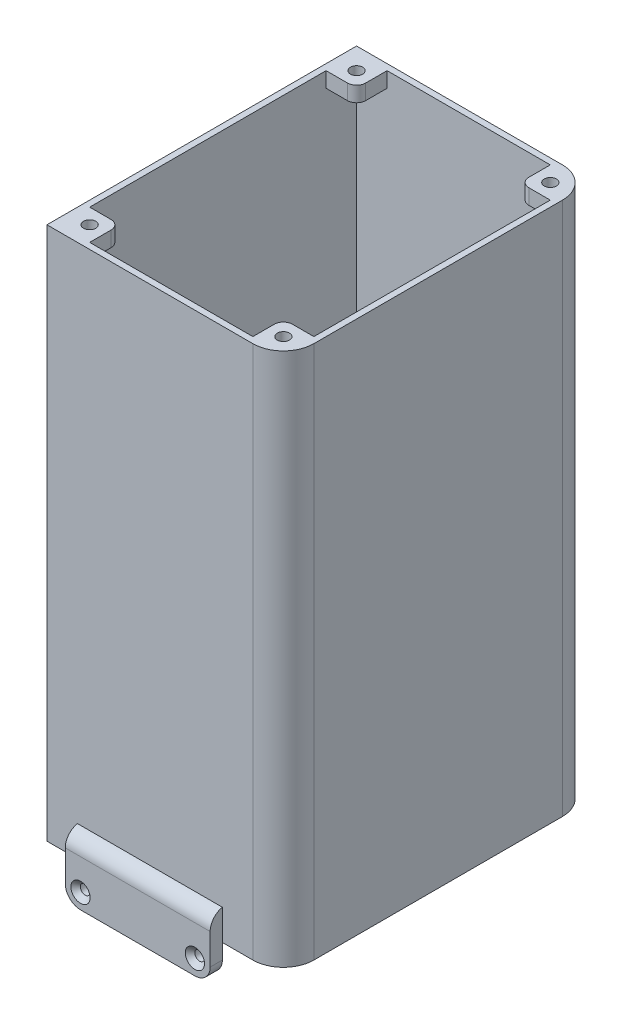
from build123d import *

# Parameters (mm, degrees)
BOSS_EXTRUDE1_DEPTH                             = 170
SKETCH3_R                                       = 2
BOSS_EXTRUDE2_DEPTH                             = 5
SKETCH4_W                                       = 47.5
SKETCH4_H                                       = 4
BOSS_EXTRUDE3_DEPTH                             = 20
FILLET1_R                                       = 5
FILLET2_R                                       = 5
CSK_FOR_M3_FLAT_HEAD_MACHINE_SCREW1_D           = 3.2
CSK_FOR_M3_FLAT_HEAD_MACHINE_SCREW1_CSINK_D     = 6.3
CSK_FOR_M3_FLAT_HEAD_MACHINE_SCREW1_CSINK_ANGLE = 90
FILLET1_OF_MIRROR1_R                            = 5
FILLET2_OF_MIRROR1_R                            = 5


with BuildPart() as part:
    # Sketch1 → Boss-Extrude1 (new body)
    with BuildSketch(Plane(origin=(0, 0, 0), x_dir=(1, 0, 0), z_dir=(0, 1, 0))):
        with BuildLine():
            Line((-38.75, -50.75), (28.75, -50.75))
            ThreePointArc((28.75, -50.75), (35.821067812, -47.821067812), (38.75, -40.75))
            Line((38.75, -40.75), (38.75, 40.75))
            ThreePointArc((38.75, 40.75), (35.821067812, 47.821067812), (28.75, 50.75))
            Line((28.75, 50.75), (-38.75, 50.75))
            Line((-38.75, 50.75), (-38.75, -50.75))
        make_face()
        with BuildLine():
            Line((-36.75, 48.75), (26.75, 48.75))
            ThreePointArc((26.75, 48.75), (33.821067812, 45.821067812), (36.75, 38.75))
            Line((36.75, 38.75), (36.75, -38.75))
            ThreePointArc((36.75, -38.75), (33.821067812, -45.821067812), (26.75, -48.75))
            Line((26.75, -48.75), (-36.75, -48.75))
            Line((-36.75, -48.75), (-36.75, 48.75))
        make_face(mode=Mode.SUBTRACT)
    extrude(amount=BOSS_EXTRUDE1_DEPTH)

    # Sketch3 → Boss-Extrude2 (add)
    with BuildSketch(Plane(origin=(0, 170, 0), x_dir=(1, 0, 0), z_dir=(0, 1, 0))):
        with BuildLine():
            Line((-38.75, 50.75), (28.75, 50.75))
            ThreePointArc((28.75, 50.75), (35.821067812, 47.821067812), (38.75, 40.75))
            Line((38.75, 40.75), (38.75, -40.75))
            ThreePointArc((38.75, -40.75), (35.821067812, -47.821067812), (28.75, -50.75))
            Line((28.75, -50.75), (-38.75, -50.75))
            Line((-38.75, -50.75), (-38.75, 50.75))
        make_face()
        with Locations(Location((-31.75, -43.75, 0), (0, 0, 270))):
            Circle(SKETCH3_R, mode=Mode.SUBTRACT)
        with Locations(Location((-31.75, 43.75, 0), (0, 0, 270))):
            Circle(SKETCH3_R, mode=Mode.SUBTRACT)
        with Locations(Location((31.75, 43.75, 0), (0, 0, 270))):
            Circle(SKETCH3_R, mode=Mode.SUBTRACT)
        with Locations(Location((31.75, -43.75, 0), (0, 0, 270))):
            Circle(SKETCH3_R, mode=Mode.SUBTRACT)
        with BuildLine():
            Line((-36.75, 38.75), (-36.75, -38.75))
            Line((-36.75, -38.75), (-29.75, -38.75))
            ThreePointArc((-29.75, -38.75), (-27.628679656, -39.628679656), (-26.75, -41.75))
            Line((-26.75, -41.75), (-26.75, -48.75))
            Line((-26.75, -48.75), (26.75, -48.75))
            Line((26.75, -48.75), (26.75, -41.75))
            ThreePointArc((26.75, -41.75), (27.628679656, -39.628679656), (29.75, -38.75))
            Line((29.75, -38.75), (36.75, -38.75))
            Line((36.75, -38.75), (36.75, 38.75))
            Line((36.75, 38.75), (29.75, 38.75))
            ThreePointArc((29.75, 38.75), (27.628679656, 39.628679656), (26.75, 41.75))
            Line((26.75, 41.75), (26.75, 48.75))
            Line((26.75, 48.75), (-26.75, 48.75))
            Line((-26.75, 48.75), (-26.75, 41.75))
            ThreePointArc((-26.75, 41.75), (-27.628679656, 39.628679656), (-29.75, 38.75))
            Line((-29.75, 38.75), (-36.75, 38.75))
        make_face(mode=Mode.SUBTRACT)
    extrude(amount=BOSS_EXTRUDE2_DEPTH)

    # Sketch4 → Boss-Extrude3 (add)
    with BuildSketch(Plane(origin=(0, 10, 0), x_dir=(-1, 0, 0), z_dir=(0, -1, 0))):
        with Locations((5, -52.75)):
            Rectangle(SKETCH4_W, SKETCH4_H)
    boss_extrude3 = extrude(amount=BOSS_EXTRUDE3_DEPTH)

    # Fillet1
    fillet1_edges = [part.edges().sort_by_distance(p)[0] for p in [
        (18.75, -10, 52.75),
        (-28.75, -10, 52.75),
    ]]
    fillet(fillet1_edges, radius=FILLET1_R)

    # Fillet2
    # the kernel refuses this fillet: 5 mm, written as the material it takes off along each edge
    with BuildSketch(Plane(origin=(-40.997448714, 10, 54.75), x_dir=(0, -1, 0), z_dir=(1, 0, 0))) as fillet2_piece_1:
        with BuildLine():
            CenterArc((4.898979486, 5), FILLET2_R, 191.536959033, 78.463040967)
            Line((0, 4), (-0.09797959, 3.98))
            ThreePointArc((-0.09797959, 3.98), (-0.1, 2), (-0.1, 0))
            Line((-0.1, 0), (0, -0.1))
            Line((0, -0.1), (4.898979486, -0.1))
            Line((4.898979486, -0.1), (4.898979486, 0))
        make_face()
    extrude(amount=71.994897428, mode=Mode.SUBTRACT)

    # CSK for M3 Flat Head Machine Screw1 (through all)
    with Locations(Plane.XY.offset(54.75)):
        with Locations((13.75, -5), (-23.75, -5)):
            csk_for_m3_flat_head_machine_screw1 = CounterSinkHole(CSK_FOR_M3_FLAT_HEAD_MACHINE_SCREW1_D / 2, CSK_FOR_M3_FLAT_HEAD_MACHINE_SCREW1_CSINK_D / 2, counter_sink_angle=CSK_FOR_M3_FLAT_HEAD_MACHINE_SCREW1_CSINK_ANGLE)

    # Mirror1: Boss-Extrude3, CSK for M3 Flat Head Machine Screw1 across plane
    add(boss_extrude3.mirror(Plane.XY))
    add(csk_for_m3_flat_head_machine_screw1.mirror(Plane.XY), mode=Mode.SUBTRACT)

    # Fillet1 of Mirror1
    fillet1_of_mirror1_edges = [part.edges().sort_by_distance(p)[0] for p in [
        (18.75, -10, -52.75),
        (-28.75, -10, -52.75),
    ]]
    fillet(fillet1_of_mirror1_edges, radius=FILLET1_OF_MIRROR1_R)

    # Fillet2 of Mirror1
    # the kernel refuses this fillet: 5 mm, written as the material it takes off along each edge
    with BuildSketch(Plane(origin=(-40.997448714, 10, -54.75), x_dir=(0, -1, 0), z_dir=(1, 0, 0))) as fillet2_of_mirror1_piece_1:
        with BuildLine():
            CenterArc((4.898979486, -5), FILLET2_OF_MIRROR1_R, 90, 78.463040967)
            Line((0, -4), (-0.09797959, -3.98))
            ThreePointArc((-0.09797959, -3.98), (-0.1, -2), (-0.1, 0))
            Line((-0.1, 0), (0, 0.1))
            Line((0, 0.1), (4.898979486, 0.1))
            Line((4.898979486, 0.1), (4.898979486, 0))
        make_face()
    extrude(amount=71.994897428, mode=Mode.SUBTRACT)


solid = part.part
